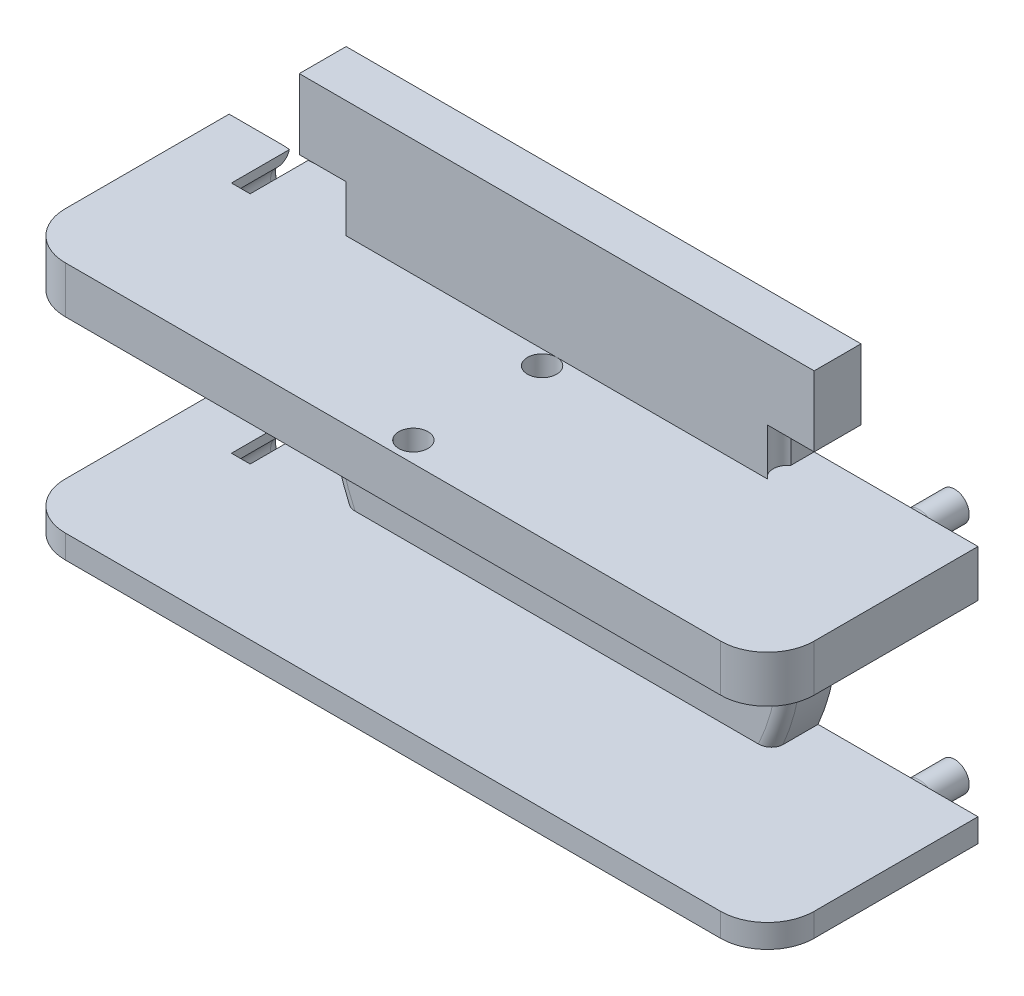
from build123d import *

# Parameters (mm, degrees)
BOSS_EXTRUDE1_DEPTH     = 2
SKETCH2_R               = 1.575
BOSS_EXTRUDE2_DEPTH     = 4
SKETCH3_R               = 1.8
BOSS_EXTRUDE3_DEPTH     = 0.75
SKETCH4_W               = 2
SKETCH4_H               = 17
BOSS_EXTRUDE4_DEPTH     = 0.001
SKETCH5_W               = 18
SKETCH5_H               = 2
BOSS_EXTRUDE5_DEPTH     = 0.001
SKETCH6_W               = 2.001
SKETCH6_H               = 2
BOSS_EXTRUDE6_DEPTH     = 5
BOSS_EXTRUDE7_DEPTH     = 0.001
CUT_EXTRUDE1_DEPTH      = 20.519323784
SKETCH9_W               = 2.937742252
SKETCH9_H               = 8
CUT_EXTRUDE2_DEPTH      = 0.001
CUT_EXTRUDE11_START     = -0.001
SKETCH21_R              = 9.75
SKETCH21_R_2            = 1.8
CUT_EXTRUDE11_DEPTH     = 0.001
SKETCH10_W              = 32
SKETCH10_H              = 2
BOSS_EXTRUDE8_DEPTH     = 7
FILLET1_R               = 0.5
SKETCH11_R              = 0.625
BOSS_EXTRUDE9_DEPTH     = 2
SKETCH14_W              = 2
SKETCH14_H              = 2
CUT_EXTRUDE5_DEPTH      = 22.401355237
SKETCH12_R              = 0.725
CUT_EXTRUDE3_DEPTH      = 2.5
CUT_EXTRUDE6_DEPTH      = 2
FILLET2_R               = 0.5
FILLET3_R               = 0.5
FILLET4_R               = 2
CUT_EXTRUDE7_DEPTH      = 26.019992106
CUT_EXTRUDE7_DEPTH_BACK = 1
SKETCH19_R              = 0.625
CUT_EXTRUDE9_DEPTH      = 2
CUT_EXTRUDE12_REACH     = 23.401


with BuildPart() as part:
    # Sketch1 → Boss-Extrude1 (new body)
    with BuildSketch(Plane.XY):
        Polygon((-11, 6), (-11, 11), (11, 11), (11, 6), (11, -6), (-11, -6), align=None)
    extrude(amount=BOSS_EXTRUDE1_DEPTH)

    # Sketch3 → Boss-Extrude3 (add)
    with BuildSketch(Plane(origin=(0, 0, 0), x_dir=(-1, 0, 0), z_dir=(0, 0, -1))):
        with Locations(Location((0, 0, 0), (0, 0, 180))):
            Circle(SKETCH3_R)
    extrude(amount=BOSS_EXTRUDE3_DEPTH)

    # Sketch4 → Boss-Extrude4 (add)
    with BuildSketch(Plane(origin=(0, 0, 0), x_dir=(-1, 0, 0), z_dir=(0, 0, -1))):
        with Locations((10, 2.5)):
            Rectangle(SKETCH4_W, SKETCH4_H)
        with Locations((-10, 2.5)):
            Rectangle(SKETCH4_W, SKETCH4_H)
    extrude(amount=BOSS_EXTRUDE4_DEPTH)

    # Sketch5 → Boss-Extrude5 (add)
    with BuildSketch(Plane(origin=(0, 0, 0), x_dir=(-1, 0, 0), z_dir=(0, 0, -1))):
        with Locations((0, 10)):
            Rectangle(SKETCH5_W, SKETCH5_H)
    extrude(amount=BOSS_EXTRUDE5_DEPTH)

    # Sketch6 → Boss-Extrude6 (add)
    with BuildSketch(Plane(origin=(11, 0, 0), x_dir=(0, 0, -1), z_dir=(1, 0, 0))):
        with Locations((-0.9995, -5)):
            Rectangle(SKETCH6_W, SKETCH6_H)
        with Locations((-0.9995, 5)):
            Rectangle(SKETCH6_W, SKETCH6_H)
    boss_extrude6 = extrude(amount=BOSS_EXTRUDE6_DEPTH)

    # Mirror1: Boss-Extrude6 across plane
    add(boss_extrude6.mirror(Plane(origin=(0, 0, 0), x_dir=(0, 0, 1), z_dir=(1, 0, 0))))

    # Sketch7 → Boss-Extrude7 (add)
    with BuildSketch(Plane(origin=(0, 0, -0.001), x_dir=(-1, 0, 0), z_dir=(0, 0, -1))):
        with BuildLine():
            ThreePointArc((-6.708203932, -6), (-8.407551231, -3.211398808), (-9, 0))
            Line((-9, 0), (-9, -6))
            Line((-9, -6), (-6.708203932, -6))
        make_face()
        with BuildLine():
            Line((-9, 9), (-9, 0))
            ThreePointArc((-9, 0), (-6.363961031, 6.363961031), (0, 9))
            Line((0, 9), (-9, 9))
        make_face()
    boss_extrude7 = extrude(amount=-BOSS_EXTRUDE7_DEPTH)

    # Sketch8 → Cut-Extrude1 (cut, through all)
    with BuildSketch(Plane(origin=(0, 0, -0.001), x_dir=(-1, 0, 0), z_dir=(0, 0, -1))):
        with BuildLine():
            Line((-11, 4), (-9.16515139, 4))
            ThreePointArc((-9.16515139, 4), (-10, 0), (-9.16515139, -4))
            Line((-9.16515139, -4), (-11, -4))
            Line((-11, -4), (-11, 4))
        make_face()
    cut_extrude1 = extrude(amount=-CUT_EXTRUDE1_DEPTH, mode=Mode.SUBTRACT)

    # Sketch9 → Cut-Extrude2 (cut)
    with BuildSketch(Plane(origin=(0, 0, -0.001), x_dir=(-1, 0, 0), z_dir=(0, 0, -1))):
        with Locations((-9.531128874, 0)):
            Rectangle(SKETCH9_W, SKETCH9_H)
    cut_extrude2 = extrude(amount=-CUT_EXTRUDE2_DEPTH, mode=Mode.SUBTRACT)

    # Mirror2: Boss-Extrude7, Cut-Extrude1, Cut-Extrude2 across plane
    add(boss_extrude7.mirror(Plane(origin=(0, 0, 0), x_dir=(0, 0, 1), z_dir=(1, 0, 0))))
    add(cut_extrude1.mirror(Plane(origin=(0, 0, 0), x_dir=(0, 0, 1), z_dir=(1, 0, 0))), mode=Mode.SUBTRACT)
    add(cut_extrude2.mirror(Plane(origin=(0, 0, 0), x_dir=(0, 0, 1), z_dir=(1, 0, 0))), mode=Mode.SUBTRACT)

    # Sketch21 → Cut-Extrude11 (cut)
    with BuildSketch(Plane(origin=(0, 0, -0.001), x_dir=(-1, 0, 0), z_dir=(0, 0, -1)).offset(CUT_EXTRUDE11_START)):
        Circle(SKETCH21_R)
        with Locations(Location((0, 0, 0), (0, 0, 180))):
            Circle(SKETCH21_R_2, mode=Mode.SUBTRACT)
    extrude(amount=CUT_EXTRUDE11_DEPTH, mode=Mode.SUBTRACT)

    # Sketch10 → Boss-Extrude8 (add)
    with BuildSketch(Plane.XY.offset(2)):
        with Locations((0, -5)):
            Rectangle(SKETCH10_W, SKETCH10_H)
        with Locations((0, 5)):
            Rectangle(SKETCH10_W, SKETCH10_H)
    extrude(amount=BOSS_EXTRUDE8_DEPTH)

    # Fillet1
    fillet1_edges = [part.edges().sort_by_distance(p)[0] for p in [
        (10, 0, 2),
        (-10, 0, 2),
    ]]
    fillet(fillet1_edges, radius=FILLET1_R)

    # Sketch11 → Boss-Extrude9 (add)
    with BuildSketch(Plane(origin=(0, 0, -0.001), x_dir=(-1, 0, 0), z_dir=(0, 0, -1))):
        with Locations(Location((-13, -5, 0), (0, 0, 180))):
            Circle(SKETCH11_R)
    boss_extrude9 = extrude(amount=BOSS_EXTRUDE9_DEPTH)

    # Sketch14 → Cut-Extrude5 (cut, through all)
    with BuildSketch(Plane(origin=(0, 0, -0.001), x_dir=(-1, 0, 0), z_dir=(0, 0, -1))):
        with Locations((10, 7)):
            Rectangle(SKETCH14_W, SKETCH14_H)
        with Locations((-10, 7)):
            Rectangle(SKETCH14_W, SKETCH14_H)
    extrude(amount=-CUT_EXTRUDE5_DEPTH, mode=Mode.SUBTRACT)

    # Sketch12 → Cut-Extrude3 (cut)
    with BuildSketch(Plane(origin=(0, 0, -0.001), x_dir=(-1, 0, 0), z_dir=(0, 0, -1))):
        with Locations((13, -5)):
            Circle(SKETCH12_R)
    cut_extrude3 = extrude(amount=-CUT_EXTRUDE3_DEPTH, mode=Mode.SUBTRACT)

    # Sketch16 → Cut-Extrude6 (cut)
    with BuildSketch(Plane(origin=(0, 6, 0), x_dir=(1, 0, 0), z_dir=(0, 1, 0))):
        with BuildLine():
            Line((-9, -1), (-9, -2))
            ThreePointArc((-9, -2), (-8.75, -1.5), (-9, -1))
        make_face()
    cut_extrude6 = extrude(amount=CUT_EXTRUDE6_DEPTH, mode=Mode.SUBTRACT)

    # Mirror3: Boss-Extrude9, Cut-Extrude3 across plane
    add(boss_extrude9.mirror(Plane.ZX))
    add(cut_extrude3.mirror(Plane.ZX), mode=Mode.SUBTRACT)

    # Mirror4: Cut-Extrude6 across plane
    add(cut_extrude6.mirror(Plane(origin=(0, 0, 0), x_dir=(0, 0, 1), z_dir=(1, 0, 0))), mode=Mode.SUBTRACT)

    # Fillet2
    fillet2_edges = [part.edges().sort_by_distance(p)[0] for p in [
        (12.375, -5, -0.001),
        (12.375, 5, -0.001),
    ]]
    fillet(fillet2_edges, radius=FILLET2_R)

    # Fillet3
    # the kernel refuses this fillet: 0.5 mm, written as the material it takes off along each edge
    with BuildSketch(Plane(origin=(-13, -5, -0.001), x_dir=(-1, 0, 0), z_dir=(0, -1, 0))) as fillet3_piece_1:
        with BuildLine():
            CenterArc((0.725 + FILLET3_R, -FILLET3_R), FILLET3_R, 90, 90)
            Line((0.725, -FILLET3_R), (0.725, 0))
            Line((0.725, 0), (0.725 + FILLET3_R, 0))
        make_face()
    revolve(axis=Axis((-13, -5, -0.001), (0, 0, -1)), mode=Mode.SUBTRACT)
    with BuildSketch(Plane(origin=(-13, 5, -0.001), x_dir=(-1, 0, 0), z_dir=(0, 1, 0))) as fillet3_piece_2:
        with BuildLine():
            CenterArc((0.725 + FILLET3_R, FILLET3_R), FILLET3_R, 180, 90)
            Line((0.725, FILLET3_R), (0.725, 0))
            Line((0.725, 0), (0.725 + FILLET3_R, 0))
        make_face()
    revolve(axis=Axis((-13, 5, -0.001), (0, 0, 1)), mode=Mode.SUBTRACT)

    # Fillet4
    fillet4_edges = [part.edges().sort_by_distance(p)[0] for p in [
        (16, -5, 9),
        (-16, -5, 9),
        (-16, 5, 9),
        (16, 5, 9),
    ]]
    fillet(fillet4_edges, radius=FILLET4_R)

    # Sketch17 → Cut-Extrude7 (cut, two sides: drawn at the far end of the back side and taken through both)
    with BuildSketch(Plane.XZ.offset(6).offset(-CUT_EXTRUDE7_DEPTH_BACK)):
        with BuildLine():
            Line((-16, 7), (-16, -0.001))
            Line((-16, -0.001), (-14.5, -0.001))
            Line((-14.5, -0.001), (-14.5, 7))
            ThreePointArc((-14.5, 7), (-14.353553391, 7.353553391), (-14, 7.5))
            Line((-14, 7.5), (14, 7.5))
            ThreePointArc((14, 7.5), (14.353553391, 7.353553391), (14.5, 7))
            Line((14.5, 7), (14.5, -0.001))
            Line((14.5, -0.001), (16, -0.001))
            Line((16, -0.001), (16, 7))
            ThreePointArc((16, 7), (15.414213562, 8.414213562), (14, 9))
            Line((14, 9), (-14, 9))
            ThreePointArc((-14, 9), (-15.414213562, 8.414213562), (-16, 7))
        make_face()
    extrude(amount=CUT_EXTRUDE7_DEPTH + CUT_EXTRUDE7_DEPTH_BACK, mode=Mode.SUBTRACT)

    # Sketch19 → Cut-Extrude9 (cut)
    with BuildSketch(Plane(origin=(0, 6, 0), x_dir=(1, 0, 0), z_dir=(0, 1, 0))):
        with Locations(Location((0, -2.625, 0), (0, 0, 90))):
            Circle(SKETCH19_R)
        with Locations(Location((0, -8.125, 0), (0, 0, 270))):
            Circle(SKETCH19_R)
    extrude(amount=-CUT_EXTRUDE9_DEPTH, mode=Mode.SUBTRACT)


with BuildPart() as body_2:
    # Sketch2 → Boss-Extrude2 (new body)
    with BuildSketch(Plane(origin=(0, 0, 2), x_dir=(-1, 0, 0), z_dir=(0, 0, -1))):
        Circle(SKETCH2_R)
    extrude(amount=BOSS_EXTRUDE2_DEPTH)


with BuildPart() as part_1:
    add(part.part)

    # Combine2: cut body 2
    add(body_2.part, mode=Mode.SUBTRACT)

    # Cut-Extrude12: up to this face of the body (flat: up to its plane)
    cut_extrude12_end = Plane(part_1.part.faces().sort_by_distance((-13, -5, 2.499))[0])
    # Sketch23 → Cut-Extrude12 (cut, up to the picked face)
    with BuildSketch(Plane(origin=(0, 0, -0.001), x_dir=(-1, 0, 0), z_dir=(0, 0, -1)), mode=Mode.PRIVATE) as cut_extrude12_sk1:
        with BuildLine():
            Line((12.6, -6), (12.6, -4))
            ThreePointArc((12.6, -4), (13, -3.6), (13.4, -4))
            Line((13.4, -4), (13.4, -6))
            ThreePointArc((13.4, -6), (13, -6.4), (12.6, -6))
        make_face()
    cut_extrude12_tool1 = split(extrude(cut_extrude12_sk1.sketch, amount=-CUT_EXTRUDE12_REACH, mode=Mode.PRIVATE), bisect_by=cut_extrude12_end, keep=Keep.BOTH, mode=Mode.PRIVATE)
    cut_extrude12 = cut_extrude12_tool1.solids().sort_by(Axis((-13, -5, -0.001), (0, 0, 1)))[0]
    add(cut_extrude12, mode=Mode.SUBTRACT)

    # Mirror5: Cut-Extrude12 across plane
    add(cut_extrude12.mirror(Plane.ZX), mode=Mode.SUBTRACT)


solid = part_1.part
